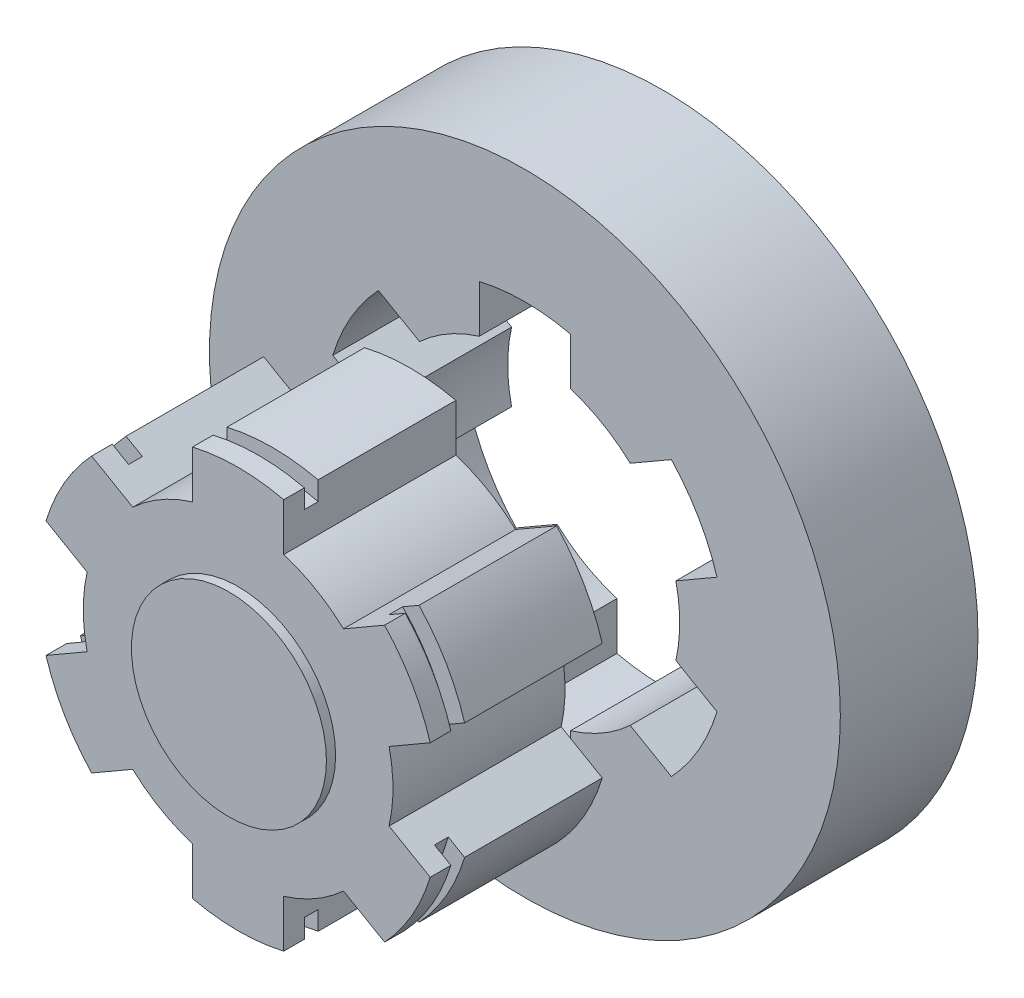
from build123d import *

# Parameters (mm, degrees)
TIRE_OUTBOARD_SPLINES_OUTLINE_R = 27.5
TIRE_OUTBOARD_SPLINES_DEPTH     = 12
BOSS_EXTRUDE1_DEPTH             = 15
CUT_EXTRUDE1_DEPTH              = 1.2
SKETCH4_R                       = 8.5
BOSS_EXTRUDE2_DEPTH             = 0.8


# Read off the part's stored shape, not the designer's step: Tire_Outboard_Splines
with BuildPart() as part:
    # Tire_Outboard_Splines outline → Tire_Outboard_Splines (new body)
    with BuildSketch(Plane.XY):
        with Locations((-29.032124352, 10.239008142)):
            Circle(TIRE_OUTBOARD_SPLINES_OUTLINE_R)
        with BuildLine():
            Line((-41.802331989, 22.204449918), (-38.215930705, 20.133840171))
            ThreePointArc((-38.215930705, 20.133840171), (-35.782124353, 21.930351093), (-33.00939708, 23.139833761))
            Line((-33.00939708, 23.139833761), (-33.00939708, 27.281053256))
            ThreePointArc((-33.00939708, 27.281053256), (-29.032124353, 27.739008142), (-25.054851625, 27.281053256))
            Line((-25.054851625, 27.281053256), (-25.054851625, 23.139833761))
            ThreePointArc((-25.054851625, 23.139833761), (-22.282124352, 21.930351093), (-19.848318, 20.133840171))
            Line((-19.848318, 20.133840171), (-16.261916715, 22.204449918))
            ThreePointArc((-16.261916715, 22.204449918), (-13.876679786, 18.989008142), (-12.284643988, 15.315611479))
            Line((-12.284643988, 15.315611479), (-15.871045273, 13.245001732))
            ThreePointArc((-15.871045273, 13.245001732), (-15.532124352, 10.239008142), (-15.871045273, 7.233014552))
            Line((-15.871045273, 7.233014552), (-12.284643988, 5.162404805))
            ThreePointArc((-12.284643988, 5.162404805), (-13.876679786, 1.489008142), (-16.261916715, -1.726433634))
            Line((-16.261916715, -1.726433634), (-19.848318, 0.344176113))
            ThreePointArc((-19.848318, 0.344176113), (-22.282124352, -1.452334809), (-25.054851625, -2.661817477))
            Line((-25.054851625, -2.661817477), (-25.054851625, -6.803036971))
            ThreePointArc((-25.054851625, -6.803036971), (-29.032124352, -7.260991858), (-33.00939708, -6.803036971))
            Line((-33.00939708, -6.803036971), (-33.00939708, -2.661817477))
            ThreePointArc((-33.00939708, -2.661817477), (-35.782124353, -1.452334809), (-38.215930705, 0.344176113))
            Line((-38.215930705, 0.344176113), (-41.802331989, -1.726433634))
            ThreePointArc((-41.802331989, -1.726433634), (-44.187568919, 1.489008142), (-45.779604717, 5.162404805))
            Line((-45.779604717, 5.162404805), (-42.193203432, 7.233014552))
            ThreePointArc((-42.193203432, 7.233014552), (-42.532124352, 10.239008142), (-42.193203432, 13.245001732))
            Line((-42.193203432, 13.245001732), (-45.779604717, 15.315611479))
            ThreePointArc((-45.779604717, 15.315611479), (-44.187568919, 18.989008142), (-41.802331989, 22.204449918))
        make_face(mode=Mode.SUBTRACT)
    extrude(amount=TIRE_OUTBOARD_SPLINES_DEPTH)


with BuildPart() as body_2:
    # Sketch3 → Boss-Extrude1 (new body)
    with BuildSketch(Plane.XY.offset(22)):
        with BuildLine():
            Line((-45.779604717, 15.315611479), (-42.193203432, 13.245001732))
            ThreePointArc((-42.193203432, 13.245001732), (-42.532124352, 10.239008142), (-42.193203432, 7.233014552))
            Line((-42.193203432, 7.233014552), (-45.779604717, 5.162404805))
            ThreePointArc((-45.779604717, 5.162404805), (-44.187568919, 1.489008142), (-41.802331989, -1.726433634))
            Line((-41.802331989, -1.726433634), (-38.215930705, 0.344176113))
            ThreePointArc((-38.215930705, 0.344176113), (-35.782124352, -1.452334809), (-33.00939708, -2.661817477))
            Line((-33.00939708, -2.661817477), (-33.00939708, -6.803036971))
            ThreePointArc((-33.00939708, -6.803036971), (-29.032124352, -7.260991858), (-25.054851625, -6.803036971))
            Line((-25.054851625, -6.803036971), (-25.054851625, -2.661817477))
            ThreePointArc((-25.054851625, -2.661817477), (-22.282124352, -1.452334809), (-19.848318, 0.344176113))
            Line((-19.848318, 0.344176113), (-16.261916715, -1.726433634))
            ThreePointArc((-16.261916715, -1.726433634), (-13.876679786, 1.489008142), (-12.284643988, 5.162404805))
            Line((-12.284643988, 5.162404805), (-15.871045273, 7.233014552))
            ThreePointArc((-15.871045273, 7.233014552), (-15.532124352, 10.239008142), (-15.871045273, 13.245001732))
            Line((-15.871045273, 13.245001732), (-12.284643988, 15.315611479))
            ThreePointArc((-12.284643988, 15.315611479), (-13.876679786, 18.989008142), (-16.261916715, 22.204449918))
            Line((-16.261916715, 22.204449918), (-19.848318, 20.133840171))
            ThreePointArc((-19.848318, 20.133840171), (-22.282124352, 21.930351093), (-25.054851625, 23.139833761))
            Line((-25.054851625, 23.139833761), (-25.054851625, 27.281053256))
            ThreePointArc((-25.054851625, 27.281053256), (-29.032124352, 27.739008142), (-33.00939708, 27.281053256))
            Line((-33.00939708, 27.281053256), (-33.00939708, 23.139833761))
            ThreePointArc((-33.00939708, 23.139833761), (-35.782124352, 21.930351093), (-38.215930705, 20.133840171))
            Line((-38.215930705, 20.133840171), (-41.802331989, 22.204449918))
            ThreePointArc((-41.802331989, 22.204449918), (-44.187568919, 18.989008142), (-45.779604717, 15.315611479))
        make_face()
    extrude(amount=BOSS_EXTRUDE1_DEPTH)

    # Sketch5 → Cut-Extrude1 (cut)
    with BuildSketch(Plane(origin=(0, 0, 34), x_dir=(-1, 0, 0), z_dir=(0, 0, -1))):
        with BuildLine():
            ThreePointArc((16.261916715, 22.204449918), (13.876679786, 18.989008142), (12.284643988, 15.315611479))
            ThreePointArc((12.284643988, 15.315611479), (11.532124352, 10.239008142), (12.284643988, 5.162404805))
            ThreePointArc((12.284643988, 5.162404805), (13.876679786, 1.489008142), (16.261916715, -1.726433634))
            ThreePointArc((16.261916715, -1.726433634), (20.282124352, -4.916436424), (25.054851625, -6.803036971))
            ThreePointArc((25.054851625, -6.803036971), (29.032124352, -7.260991858), (33.00939708, -6.803036971))
            ThreePointArc((33.00939708, -6.803036971), (37.782124352, -4.916436424), (41.802331989, -1.726433634))
            ThreePointArc((41.802331989, -1.726433634), (44.187568919, 1.489008142), (45.779604717, 5.162404805))
            ThreePointArc((45.779604717, 5.162404805), (46.532124352, 10.239008142), (45.779604717, 15.315611479))
            ThreePointArc((45.779604717, 15.315611479), (44.187568919, 18.989008142), (41.802331989, 22.204449918))
            ThreePointArc((41.802331989, 22.204449918), (37.782124352, 25.394452708), (33.00939708, 27.281053256))
            ThreePointArc((33.00939708, 27.281053256), (29.032124352, 27.739008142), (25.054851625, 27.281053256))
            ThreePointArc((25.054851625, 27.281053256), (20.282124352, 25.394452708), (16.261916715, 22.204449918))
        make_face()
        with BuildLine():
            ThreePointArc((13.815842193, 5.626551396), (13.132124352, 10.239008142), (13.815842193, 14.851464888))
            ThreePointArc((13.815842193, 14.851464888), (15.262320432, 18.189008142), (17.429478556, 21.11046667))
            ThreePointArc((17.429478556, 21.11046667), (21.082124352, 24.008812062), (25.418487989, 25.722923417))
            ThreePointArc((25.418487989, 25.722923417), (29.032124352, 26.139008142), (32.645760716, 25.722923417))
            ThreePointArc((32.645760716, 25.722923417), (36.982124352, 24.008812062), (40.634770148, 21.11046667))
            ThreePointArc((40.634770148, 21.11046667), (42.801928273, 18.189008142), (44.248406512, 14.851464888))
            ThreePointArc((44.248406512, 14.851464888), (44.932124352, 10.239008142), (44.248406512, 5.626551396))
            ThreePointArc((44.248406512, 5.626551396), (42.801928273, 2.289008142), (40.634770148, -0.632450386))
            ThreePointArc((40.634770148, -0.632450386), (36.982124352, -3.530795778), (32.645760716, -5.244907132))
            ThreePointArc((32.645760716, -5.244907132), (29.032124352, -5.660991858), (25.418487989, -5.244907132))
            ThreePointArc((25.418487989, -5.244907132), (21.082124352, -3.530795778), (17.429478556, -0.632450386))
            ThreePointArc((17.429478556, -0.632450386), (15.262320432, 2.289008142), (13.815842193, 5.626551396))
        make_face(mode=Mode.SUBTRACT)
    extrude(amount=-CUT_EXTRUDE1_DEPTH, mode=Mode.SUBTRACT)

    # Sketch4 → Boss-Extrude2 (add)
    with BuildSketch(Plane.XY.offset(37)):
        with Locations((-29.032124352, 10.239008142)):
            Circle(SKETCH4_R)
    extrude(amount=BOSS_EXTRUDE2_DEPTH)


solid = Compound([part.part, body_2.part])
